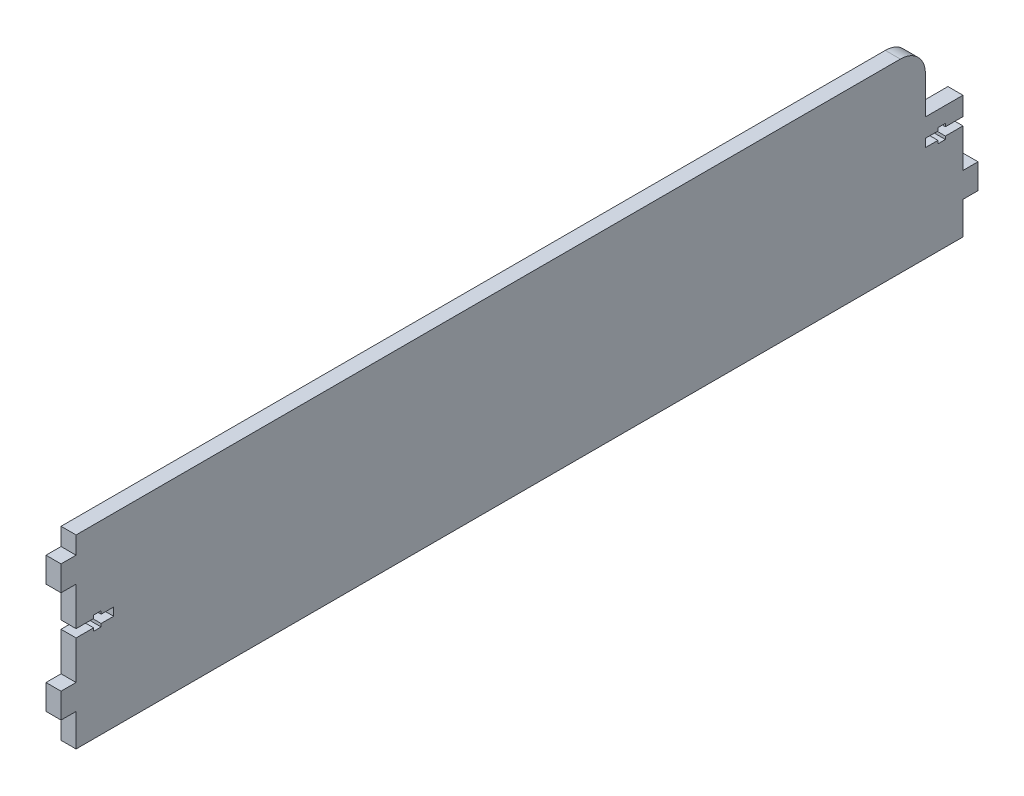
from build123d import *

# Parameters (mm, degrees)
SKETCH1_W           = 354
SKETCH1_H           = 80
BOSS_EXTRUDE1_DEPTH = 6
SKETCH4_W           = 6
SKETCH4_H           = 10
BOSS_EXTRUDE2_DEPTH = 6
CUT_EXTRUDE3_REACH  = 189.417
SKETCH7_W           = 6
SKETCH7_H           = 10
BOSS_EXTRUDE3_DEPTH = 6
SKETCH8_W           = 6
SKETCH8_H           = 354
CUT_EXTRUDE4_DEPTH  = 6
SKETCH9_W           = 6
SKETCH9_H           = 15
CUT_EXTRUDE5_DEPTH  = 25
FILLET1_R           = 10


with BuildPart() as part:
    # Sketch1 → Boss-Extrude1 (new body)
    with BuildSketch(Plane(origin=(0, 0, 0), x_dir=(0, 0, -1), z_dir=(1, 0, 0))):
        Rectangle(SKETCH1_W, SKETCH1_H)
    extrude(amount=BOSS_EXTRUDE1_DEPTH)

    # Sketch4 → Boss-Extrude2 (add)
    with BuildSketch(Plane.XY.offset(177)):
        with Locations((3, 22)):
            Rectangle(SKETCH4_W, SKETCH4_H)
        with Locations((3, -22)):
            Rectangle(SKETCH4_W, SKETCH4_H)
    extrude(amount=BOSS_EXTRUDE2_DEPTH)

    # Sketch5 → Cut-Extrude3 (cut, up to next)
    with BuildSketch(Plane.ZY, mode=Mode.PRIVATE) as cut_extrude3_sk1:
        Polygon((-170, 1.6), (-177, 1.6), (-177, -1.6), (-170, -1.6), (-170, -2.8), (-167, -2.8), (-167, -1.6), (-162, -1.6), (-162, 1.6), (-167, 1.6), (-167, 2.8), (-170, 2.8), align=None)
    cut_extrude3_tool1 = extrude(cut_extrude3_sk1.sketch, amount=-CUT_EXTRUDE3_REACH, mode=Mode.PRIVATE) & part.part
    # Sketch5 → Cut-Extrude3 (cut, up to next)
    with BuildSketch(Plane.ZY, mode=Mode.PRIVATE) as cut_extrude3_sk2:
        Polygon((170, -1.6), (177, -1.6), (177, 1.6), (170, 1.6), (170, 2.8), (167, 2.8), (167, 1.6), (162, 1.6), (162, -1.6), (167, -1.6), (167, -2.8), (170, -2.8), align=None)
    cut_extrude3_tool2 = extrude(cut_extrude3_sk2.sketch, amount=-CUT_EXTRUDE3_REACH, mode=Mode.PRIVATE) & part.part
    add(cut_extrude3_tool1.solids().sort_by_distance((0, 0, -169.369565))[0], mode=Mode.SUBTRACT)
    add(cut_extrude3_tool2.solids().sort_by_distance((0, 0, 169.369565))[0], mode=Mode.SUBTRACT)

    # Sketch7 → Boss-Extrude3 (add)
    with BuildSketch(Plane(origin=(0, 0, -177), x_dir=(-1, 0, 0), z_dir=(0, 0, -1))):
        with Locations((-3, -22)):
            Rectangle(SKETCH7_W, SKETCH7_H)
    extrude(amount=BOSS_EXTRUDE3_DEPTH)

    # Sketch8 → Cut-Extrude4 (cut)
    with BuildSketch(Plane(origin=(0, 40, 0), x_dir=(1, 0, 0), z_dir=(0, 1, 0))):
        with Locations((3, 0)):
            Rectangle(SKETCH8_W, SKETCH8_H)
    extrude(amount=-CUT_EXTRUDE4_DEPTH, mode=Mode.SUBTRACT)

    # Sketch9 → Cut-Extrude5 (cut)
    with BuildSketch(Plane(origin=(0, 34, 0), x_dir=(1, 0, 0), z_dir=(0, 1, 0))):
        with Locations((3, 169.5)):
            Rectangle(SKETCH9_W, SKETCH9_H)
    extrude(amount=-CUT_EXTRUDE5_DEPTH, mode=Mode.SUBTRACT)

    # Fillet1
    fillet1_edges = [part.edges().sort_by_distance(p)[0] for p in [
        (3, 34, -162),
    ]]
    fillet(fillet1_edges, radius=FILLET1_R)


solid = part.part
